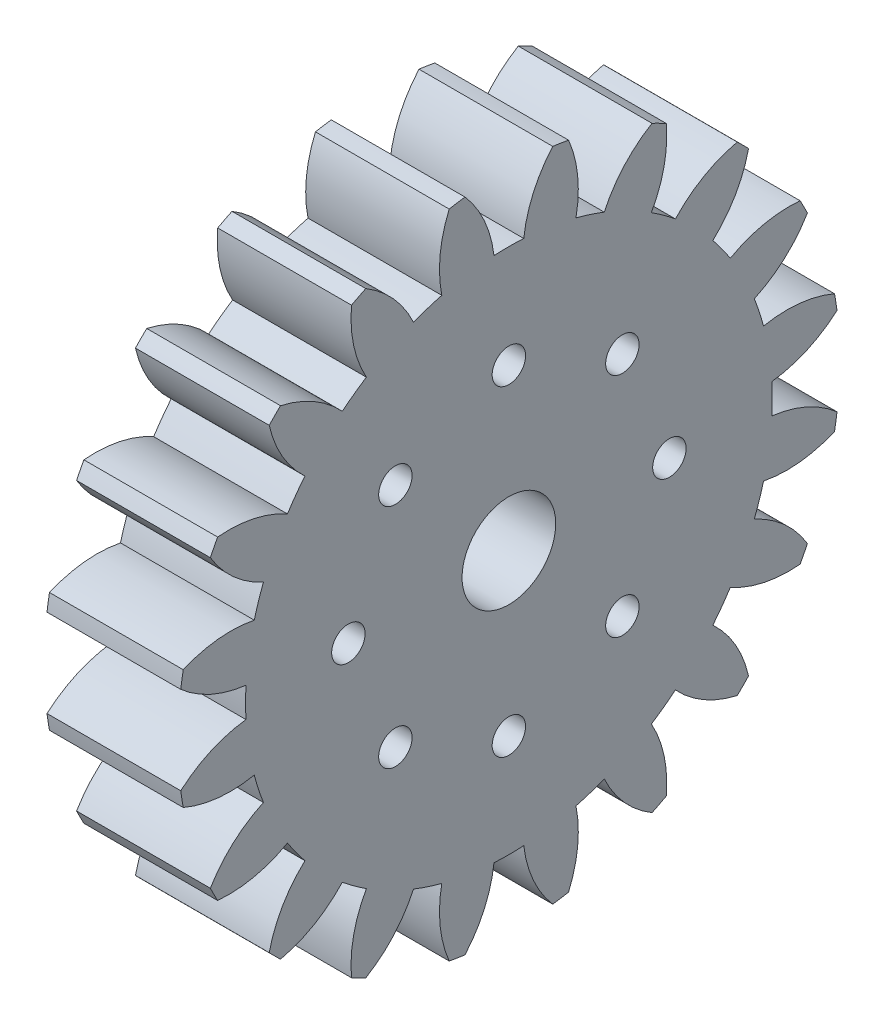
from build123d import *

# Parameters (mm, degrees)
BASPROSKE_W         = 10
BASPROSKE_H         = 24.75
TOOTHCUT_DEPTH      = 37.402266413
TEETHCUTS_COUNT     = 20
TEETHCUTS_ANGLE     = 342
BORSKE_R            = 15
BORE_DEPTH          = 50.0000508
SKETCH1_R           = 15
BOSS_EXTRUDE1_DEPTH = 5
SKETCH2_R           = 3.5
CUT_EXTRUDE1_DEPTH  = 5
SKETCH3_R           = 1.25
CUT_EXTRUDE2_DEPTH  = 5


with BuildPart() as part:
    # BasProSke → Base-Revolve (revolve)
    with BuildSketch(Plane(origin=(0, 0, 0), x_dir=(1, 0, 0), z_dir=(0, 1, 0))):
        with Locations((5, 12.375)):
            Rectangle(BASPROSKE_W, BASPROSKE_H)
    revolve(axis=Axis((-10, 0, 0), (1, 0, 0)))

    # TooCutSke → ToothCut (cut, through all)
    with BuildSketch(Plane(origin=(0, 0, 0), x_dir=(0, 0, -1), z_dir=(1, 0, 0))):
        with BuildLine():
            ThreePointArc((1.111948432, 19.655071939), (0, 19.6865), (-1.111948432, 19.655071939))
            ThreePointArc((-1.111948432, 19.655071939), (-1.832349961, 22.271720111), (-3.300041734, 24.55463642))
            ThreePointArc((-3.300041734, 24.55463642), (0, 24.7754), (3.300041734, 24.55463642))
            ThreePointArc((3.300041734, 24.55463642), (1.832349961, 22.271720111), (1.111948432, 19.655071939))
        make_face()
    toothcut = extrude(amount=TOOTHCUT_DEPTH, mode=Mode.SUBTRACT)

    # TeethCuts: ToothCut ×20 about axis
    teethcuts_axis = Axis((-10, 0, 0), (1, 0, 0))
    for i in range(1, TEETHCUTS_COUNT):
        add(toothcut.rotate(teethcuts_axis, i * TEETHCUTS_ANGLE / (TEETHCUTS_COUNT - 1)), mode=Mode.SUBTRACT)

    # BorSke → Bore (cut, symmetric)
    with BuildSketch(Plane(origin=(0, 0, 0), x_dir=(0, 0, -1), z_dir=(1, 0, 0))):
        Circle(BORSKE_R)
    extrude(amount=BORE_DEPTH, both=True, mode=Mode.SUBTRACT)

    # Sketch1 → Boss-Extrude1 (add)
    with BuildSketch(Plane(origin=(10, 0, 0), x_dir=(0, 0, -1), z_dir=(1, 0, 0))):
        Circle(SKETCH1_R)
    extrude(amount=-BOSS_EXTRUDE1_DEPTH)

    # Sketch2 → Cut-Extrude1 (cut)
    with BuildSketch(Plane(origin=(10, 0, 0), x_dir=(0, 0, -1), z_dir=(1, 0, 0))):
        Circle(SKETCH2_R)
    extrude(amount=-CUT_EXTRUDE1_DEPTH, mode=Mode.SUBTRACT)

    # Sketch3 → Cut-Extrude2 (cut)
    with BuildSketch(Plane(origin=(10, 0, 0), x_dir=(0, 0, -1), z_dir=(1, 0, 0))):
        with Locations((0, 12)):
            Circle(SKETCH3_R)
        with Locations((8.485281374, 8.485281374)):
            Circle(SKETCH3_R)
        with Locations((12, 0)):
            Circle(SKETCH3_R)
        with Locations((8.485281374, -8.485281374)):
            Circle(SKETCH3_R)
        with Locations((0, -12)):
            Circle(SKETCH3_R)
        with Locations((-8.485281374, -8.485281374)):
            Circle(SKETCH3_R)
        with Locations((-12, 0)):
            Circle(SKETCH3_R)
        with Locations((-8.485281374, 8.485281374)):
            Circle(SKETCH3_R)
    extrude(amount=-CUT_EXTRUDE2_DEPTH, mode=Mode.SUBTRACT)


solid = part.part
